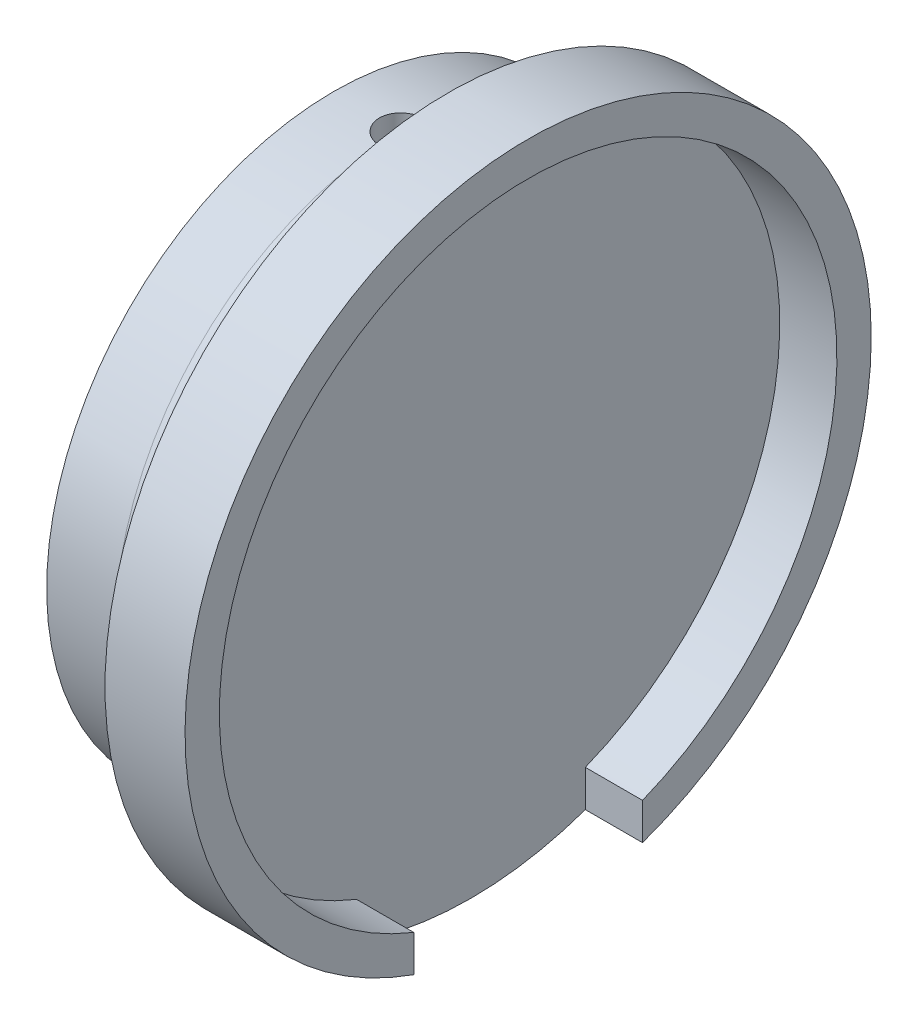
from build123d import *

# Parameters (mm, degrees)
SKETCH_1_R                      = 12.55
EXTRUDE_1_DEPTH                 = 6
SKETCH_2_R                      = 3.2
CUT_EXTRUDE_1_DEPTH             = 6
CUT_EXTRUDE_2_REACH             = 20.735
SKETCH_3_R                      = 1
CUT_EXTRUDE_2_DIRECTION_2_REACH = 20.735
EXTRUDE_2_DEPTH                 = 2.5
EXTRUDE_2_DEPTH_BACK            = 1
SKETCH_4_R                      = 15
SKETCH_5_R                      = 13.5
CUT_EXTRUDE_3_DEPTH             = 2.5
FILLET_2_R                      = 2
SKETCH_7_W                      = 2.5
SKETCH_7_H                      = 10
CUT_EXTRUDE_4_DEPTH             = 21


with BuildPart() as part:
    # 草图1 → 凸台-拉伸1 (new body)
    with BuildSketch(Plane(origin=(0, 0, 0), x_dir=(0, 0, -1), z_dir=(1, 0, 0))):
        Circle(SKETCH_1_R)
    extrude(amount=EXTRUDE_1_DEPTH)

    # 草图2 → 切除-拉伸1 (cut)
    with BuildSketch(Plane.ZY):
        Circle(SKETCH_2_R)
    extrude(amount=-CUT_EXTRUDE_1_DEPTH, mode=Mode.SUBTRACT)

    # 草图3 → 切除-拉伸2 (cut, up to next)
    with BuildSketch(Plane(origin=(0, 0, 0), x_dir=(1, 0, 0), z_dir=(0, 1, 0)), mode=Mode.PRIVATE) as cut_extrude_2_sk1:
        with Locations(Location((3, 0, 0), (0, 0, 270))):
            Circle(SKETCH_3_R)
    cut_extrude_2_tool1 = extrude(cut_extrude_2_sk1.sketch, amount=-CUT_EXTRUDE_2_REACH, mode=Mode.PRIVATE) & part.part
    add(cut_extrude_2_tool1.solids().sort_by_distance((3, 0, 0))[0], mode=Mode.SUBTRACT)

    # 草图3 → 切除-拉伸2 direction 2 (cut, up to next)
    with BuildSketch(Plane(origin=(0, 0, 0), x_dir=(1, 0, 0), z_dir=(0, 1, 0)), mode=Mode.PRIVATE) as cut_extrude_2_direction_2_sk1:
        with Locations(Location((3, 0, 0), (0, 0, 270))):
            Circle(SKETCH_3_R)
    cut_extrude_2_direction_2_tool1 = extrude(cut_extrude_2_direction_2_sk1.sketch, amount=CUT_EXTRUDE_2_DIRECTION_2_REACH, mode=Mode.PRIVATE) & part.part
    add(cut_extrude_2_direction_2_tool1.solids().sort_by_distance((3, 0, 0))[0], mode=Mode.SUBTRACT)

    # 草图4 → 凸台-拉伸2 (add, two sides: drawn at the far end of the back side and taken through both)
    with BuildSketch(Plane(origin=(6, 0, 0), x_dir=(0, 0, -1), z_dir=(1, 0, 0)).offset(-EXTRUDE_2_DEPTH_BACK)):
        Circle(SKETCH_4_R)
    extrude(amount=EXTRUDE_2_DEPTH + EXTRUDE_2_DEPTH_BACK)

    # 草图5 → 切除-拉伸3 (cut)
    with BuildSketch(Plane(origin=(8.5, 0, 0), x_dir=(0, 0, -1), z_dir=(1, 0, 0))):
        Circle(SKETCH_5_R)
    extrude(amount=-CUT_EXTRUDE_3_DEPTH, mode=Mode.SUBTRACT)

    # 圆角2
    # the kernel refuses this fillet: 2 mm, written as the material it adds along each edge
    with BuildSketch(Plane(origin=(5, 0, 0), x_dir=(0, 0, -1), z_dir=(0, 1, 0))) as fillet_2_piece_1_section:
        with BuildLine():
            CenterArc((12.55 + FILLET_2_R, FILLET_2_R), FILLET_2_R, 180, 90)
            Line((12.55 + FILLET_2_R, 0), (12.55, 0))
            Line((12.55, 0), (12.55, FILLET_2_R))
        make_face()
    fillet_2_piece_1 = revolve(axis=Axis((5, 0, 0), (-1, 0, 0)), mode=Mode.PRIVATE)
    fillet_2_piece_1 = fillet_2_piece_1 - Plane(origin=(3, 0, 0), x_dir=(0, 0, 1), z_dir=(0, -1, 0)) * Cylinder(1, 59, mode=Mode.PRIVATE)
    add(fillet_2_piece_1)

    # 草图7 → 切除-拉伸4 (cut)
    with BuildSketch(Plane(origin=(0, 0, 0), x_dir=(1, 0, 0), z_dir=(0, 1, 0))):
        with Locations((7.25, 0)):
            Rectangle(SKETCH_7_W, SKETCH_7_H)
    extrude(amount=-CUT_EXTRUDE_4_DEPTH, mode=Mode.SUBTRACT)


solid = part.part
